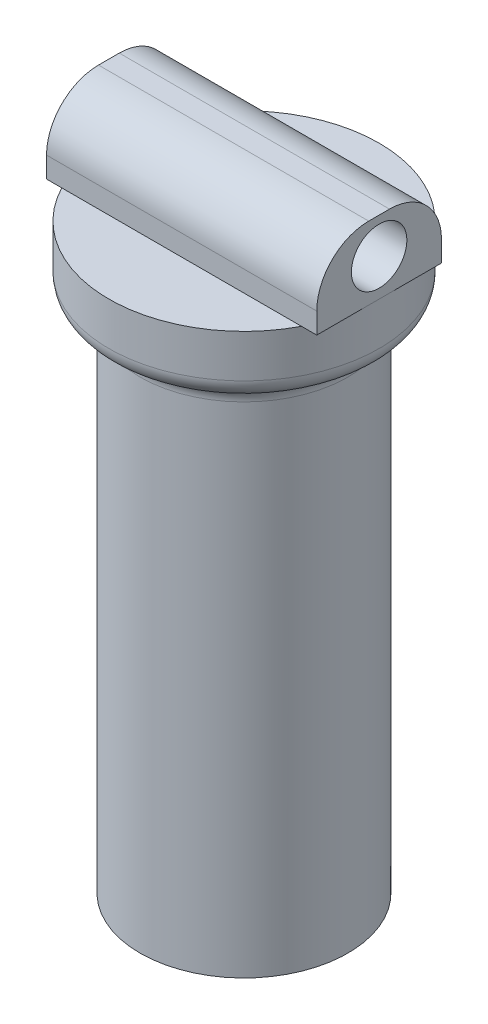
from build123d import *

# Parameters (mm, degrees)
SKETCH1_R           = 65
BOSS_EXTRUDE1_DEPTH = 30
SKETCH2_R           = 50
BOSS_EXTRUDE2_DEPTH = 250
FILLET1_R           = 10
FILLET2_R           = 10
SKETCH3_W           = 60
SKETCH3_H           = 35
BOSS_EXTRUDE3_DEPTH = 65
SKETCH4_R           = 13.35
CUT_EXTRUDE1_DEPTH  = 130
FILLET3_R           = 25


with BuildPart() as part:
    # Sketch1 → Boss-Extrude1 (new body)
    with BuildSketch(Plane(origin=(0, 0, 0), x_dir=(1, 0, 0), z_dir=(0, 1, 0))):
        with Locations(Location((0, 0, 0), (0, 0, 270))):
            Circle(SKETCH1_R)
    extrude(amount=BOSS_EXTRUDE1_DEPTH)

    # Sketch2 → Boss-Extrude2 (add)
    with BuildSketch(Plane.XZ):
        with Locations(Location((0, 0, 0), (0, 0, 90))):
            Circle(SKETCH2_R)
    extrude(amount=BOSS_EXTRUDE2_DEPTH)

    # Fillet1
    fillet1_edges = [part.edges().sort_by_distance(p)[0] for p in [
        (0, 0, -50),
    ]]
    fillet(fillet1_edges, radius=FILLET1_R)

    # Fillet2
    # the kernel refuses this fillet: 10 mm, written as the material it takes off along each edge
    with BuildSketch(Plane(origin=(0, 0, 0), x_dir=(0, 0, 1), z_dir=(-1, 0, 0))) as fillet2_piece_1:
        with BuildLine():
            CenterArc((55, 9.364916731), FILLET2_R, 284.477512186, 75.522487814)
            Line((65, 9.364916731), (66, 9.364916731))
            Line((66, 9.364916731), (66, 0))
            Line((66, 0), (65, -1))
            ThreePointArc((65, -1), (60, -1), (57.75, -1.285787471))
            Line((57.75, -1.285787471), (57.5, -0.317541634))
        make_face()
    revolve(axis=Axis((0, 0, 0), (0, 1, 0)), mode=Mode.SUBTRACT)

    # Sketch3 → Boss-Extrude3 (add, symmetric)
    with BuildSketch(Plane(origin=(0, 0, 0), x_dir=(0, 0, -1), z_dir=(1, 0, 0))):
        with Locations((0, 47.5)):
            Rectangle(SKETCH3_W, SKETCH3_H)
    extrude(amount=BOSS_EXTRUDE3_DEPTH, both=True)

    # Sketch4 → Cut-Extrude1 (cut)
    with BuildSketch(Plane(origin=(65, 0, 0), x_dir=(0, 0, -1), z_dir=(1, 0, 0))):
        with Locations((0, 47.897467929)):
            Circle(SKETCH4_R)
    extrude(amount=-CUT_EXTRUDE1_DEPTH, mode=Mode.SUBTRACT)

    # Fillet3
    fillet3_edges = [part.edges().sort_by_distance(p)[0] for p in [
        (0, 65, 30),
        (0, 65, -30),
    ]]
    fillet(fillet3_edges, radius=FILLET3_R)


solid = part.part
